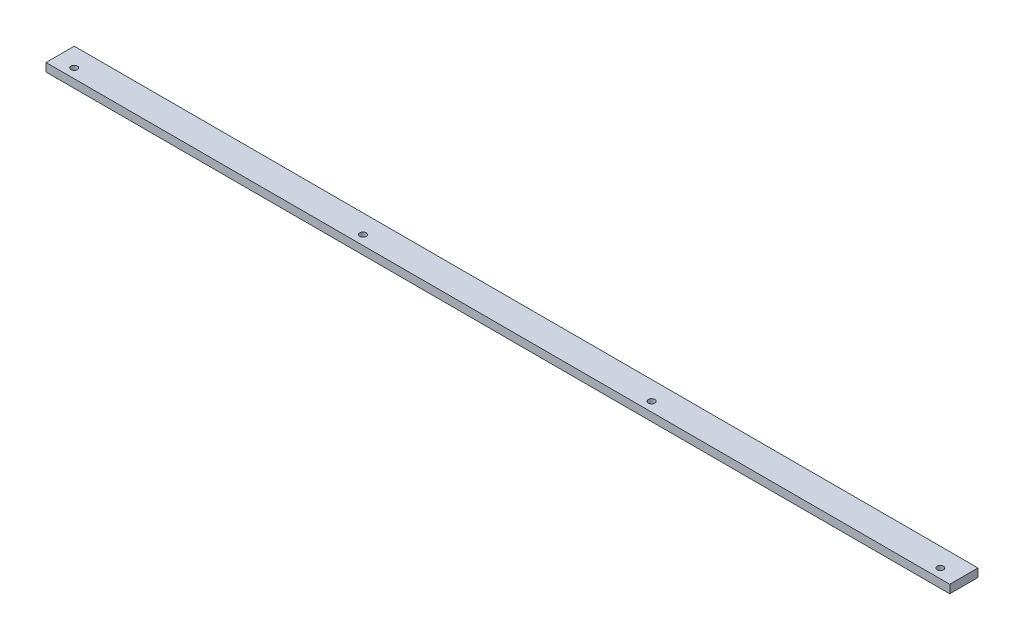
from build123d import *

# Parameters (mm, degrees)
SKETCH1_W             = 609.6
SKETCH1_H             = 19.05
BOSS_EXTRUDE1_DEPTH   = 5.588
F_8_CLEARANCE_HOLE1_D = 4.3053


with BuildPart() as part:
    # Sketch1 → Boss-Extrude1 (new body)
    with BuildSketch(Plane(origin=(0, 0, 0), x_dir=(1, 0, 0), z_dir=(0, 1, 0))):
        Rectangle(SKETCH1_W, SKETCH1_H)
    extrude(amount=BOSS_EXTRUDE1_DEPTH)

    # #8 Clearance Hole1 (through all)
    with Locations(Plane(origin=(0, 0, 0), x_dir=(-1, 0, 0), z_dir=(0, -1, 0))):
        with Locations((-292.1, -3.175), (-97.366666667, -3.175), (97.366666667, -3.175), (292.1, -3.175)):
            Hole(F_8_CLEARANCE_HOLE1_D / 2)


solid = part.part
